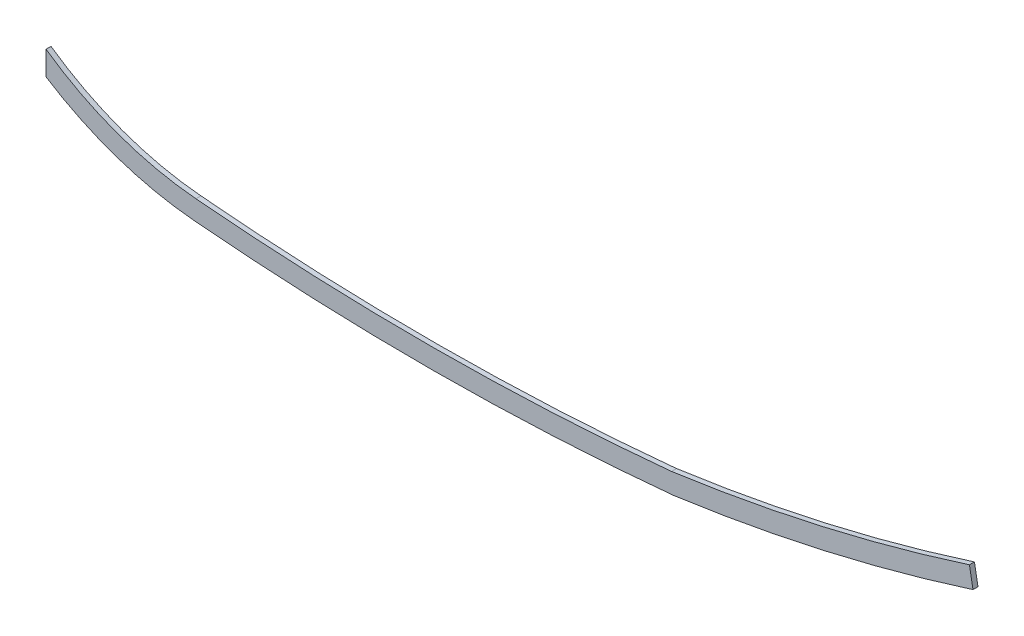
from build123d import *

# Parameters (mm, degrees)
BOSS_EXTRUDE1_DEPTH = 3.175


with BuildPart() as part:
    # Sketch2 → Boss-Extrude1 (new body)
    with BuildSketch(Plane.XY):
        with BuildLine():
            Line((0, -93.726), (0, -78.486))
            ThreePointArc((0, -78.486), (45.497909529, -102.143988159), (95.5675, -113.225336692))
            ThreePointArc((95.5675, -113.225336692), (247.168367606, -119.728946816), (398.720709803, -112.17861051))
            ThreePointArc((398.720709803, -112.17861051), (494.586291489, -94.575813643), (588.578984507, -68.779653684))
            Line((588.578984507, -68.779653684), (590.864339182, -81.353629169))
            ThreePointArc((590.864339182, -81.353629169), (496.464017617, -107.14437724), (400.203586993, -124.765753286))
            ThreePointArc((400.203586993, -124.765753286), (247.115945932, -132.400573942), (93.98, -125.805242584))
            ThreePointArc((93.98, -125.805242584), (45.058861039, -115.423125179), (0, -93.726))
        make_face()
    extrude(amount=-BOSS_EXTRUDE1_DEPTH)


solid = part.part
